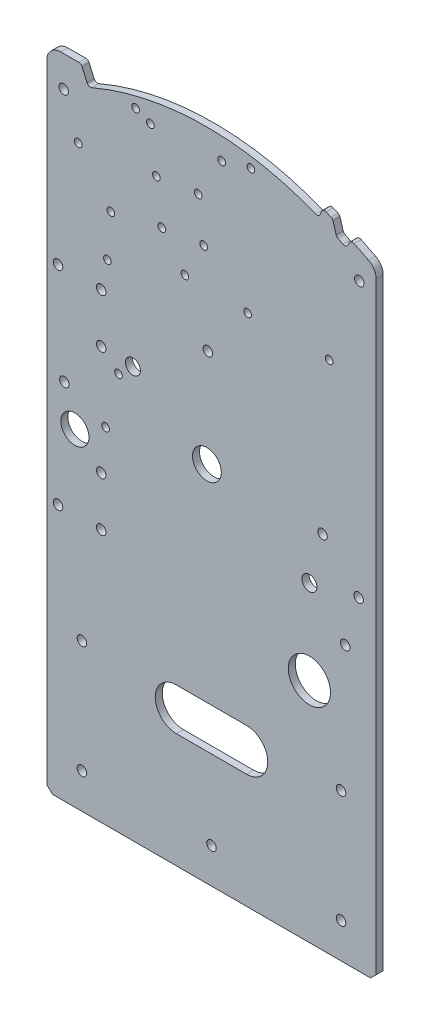
from build123d import *

# Parameters (mm, degrees)
BOSS_EXTRUDE1_DEPTH             = 3.175
SKETCH2_R                       = 6.50875
CUT_EXTRUDE1_DEPTH              = 268.458155353
F_4_CLEARANCE_HOLE1_D           = 3.4544
F_6_CLEARANCE_HOLE2_D           = 4.3053
F_4_CLEARANCE_HOLE2_D           = 3.4544
F_1_4_CLEARANCE_HOLE2_D         = 6.7564
SKETCH15_W                      = 148.719955274
SKETCH15_H                      = 114.3
BOSS_EXTRUDE2_DEPTH             = 3.175
F_6_CLEARANCE_HOLE3_D           = 4.3053
CHAMFER1_SIZE                   = 2.54
F_6_CLEARANCE_HOLE4_D           = 4.3053
F_4_CLEARANCE_HOLE3_D           = 3.4544
F_6_CLEARANCE_HOLE1_D           = 4.3053
DELETEFACE1_START               = -3.175
DELETEFACE1_OUTLINE_R           = 2.15265
DELETEFACE1_DEPTH               = 3.175
F_1_2_0_5_DIAMETER_HOLE1_D      = 12.7
F_1_4_CLEARANCE_HOLE1_D         = 6.7564
F_3_4_0_75_DIAMETER_HOLE1_D     = 19.05
F_3_4_START                     = -3.175
F_3_4_0_75_DIAMETER_SLOT1_DEPTH = 3.175
FILLET1_R                       = 1.5875
FILLET2_R                       = 6.35


# Read off the part's stored shape, not the designer's step: DeleteFace1, 3/4 (0.75) Diameter Slot1
with BuildPart() as part:
    # Sketch1 → Boss-Extrude1 (new body)
    with BuildSketch(Plane.XY):
        with BuildLine():
            Line((-37.014245685, -65.193042462), (-37.014245685, -242.993042462))
            Line((-37.014245685, -242.993042462), (111.705709589, -242.993042462))
            Line((111.705709589, -242.993042462), (111.705709589, -78.837199032))
            Line((111.705709589, -78.837199032), (100.315919098, -73.219132409))
            Line((100.315919098, -73.219132409), (98.04889923, -77.407452736))
            ThreePointArc((98.04889923, -77.407452736), (95.944511883, -76.292837527), (93.820355363, -75.216374688))
            Line((93.820355363, -75.216374688), (91.991959695, -69.073183497))
            Line((91.991959695, -69.073183497), (87.625459733, -67.171845985))
            Line((87.625459733, -67.171845985), (85.800454124, -71.570795948))
            ThreePointArc((85.800454124, -71.570795948), (33.712742218, -61.505341345), (-18.130011823, -72.76464689))
            Line((-18.130011823, -72.76464689), (-20.055584156, -68.408779876))
            Line((-20.055584156, -68.408779876), (-21.49685031, -65.148469374))
            Line((-21.49685031, -65.148469374), (-28.430836618, -65.168386968))
            Line((-28.430836618, -65.168386968), (-37.014245685, -65.193042462))
        make_face()
    extrude(amount=-BOSS_EXTRUDE1_DEPTH)

    # Sketch2 → Cut-Extrude1 (cut, through all)
    with BuildSketch(Plane.XY):
        with Locations((35.268404938, -193.371995598)):
            Circle(SKETCH2_R)
    extrude(amount=-CUT_EXTRUDE1_DEPTH, mode=Mode.SUBTRACT)

    # #4 Clearance Hole1 (through all)
    with Locations(Plane.XY):
        with Locations((41.939844363, -71.488811907), (9.789450293, -73.011273216), (90.488583573, -124.967078721), (53.658735514, -125.072870965), (25.338848707, -124.341705755), (-9.634401538, -135.888162669), (55.145248163, -67.700310852), (3.101953943, -70.270684884)):
            Hole(F_4_CLEARANCE_HOLE1_D / 2)

    # #6 Clearance Hole2 (through all)
    with Locations(Plane.XY):
        with Locations((-29.394245685, -79.071995598), (104.085709589, -87.326995598), (35.695953558, -148.921995598), (26.485754315, -79.071995598)):
            Hole(F_6_CLEARANCE_HOLE2_D / 2)

    # #4 Clearance Hole2 (through all)
    with Locations(Plane.XY):
        with Locations((-8.073739309, -116.319383279), (-22.812224861, -96.782058908), (-10.478566815, -201.738004366), (-4.603970045, -177.980497914)):
            Hole(F_4_CLEARANCE_HOLE2_D / 2)

    # 1/4 Clearance Hole2 (through all)
    with Locations(Plane.XY):
        with Locations((81.551198953, -216.670082089)):
            Hole(F_1_4_CLEARANCE_HOLE2_D / 2)

    # Sketch15 → Boss-Extrude2 (add, through all)
    with BuildSketch(Plane.XY):
        with Locations((37.345731952, -300.143042462)):
            Rectangle(SKETCH15_W, SKETCH15_H)
    extrude(amount=-BOSS_EXTRUDE2_DEPTH)

    # #6 Clearance Hole3 (through all)
    with Locations(Plane.XY):
        with Locations((-29.076745685, -193.371995598), (103.768209589, -211.243042462), (87.470455138, -194.579117263), (97.722907594, -232.841790729)):
            Hole(F_6_CLEARANCE_HOLE3_D / 2)

    # Chamfer1
    chamfer1_edges = [part.edges().sort_by_distance(p)[0] for p in [
        (-37.014245685, -357.293042462, -1.5875),
        (111.705709589, -357.293042462, -1.5875),
    ]]
    chamfer(chamfer1_edges, length=CHAMFER1_SIZE)

    # #6 Clearance Hole4 (through all)
    with Locations(Plane.XY):
        with Locations((95.830709589, -341.418042462), (37.345731952, -341.418042462), (-21.139245685, -341.418042462), (95.830709589, -290.618042462), (-21.139245685, -290.618042462)):
            Hole(F_6_CLEARANCE_HOLE4_D / 2)

    # #4 Clearance Hole3 (through all)
    with Locations(Plane.XY):
        with Locations((31.354393952, -89.701374676), (12.464345577, -92.164821934), (14.927792835, -111.054870309), (33.81784121, -108.591423051)):
            Hole(F_4_CLEARANCE_HOLE3_D / 2)

    # #6 Clearance Hole1 (through all)
    with Locations(Plane.XY):
        with Locations((-12.436474575, -171.172679278), (-12.436474575, -148.947679278), (-31.934245685, -148.947679278), (-31.934245685, -242.800679278), (-12.436474575, -242.800679278), (-12.436474575, -220.575679278)):
            Hole(F_6_CLEARANCE_HOLE1_D / 2)

    # DeleteFace1 outline → DeleteFace1 (add)
    with BuildSketch(Plane.XY.offset(DELETEFACE1_START)):
        with Locations((26.485754315, -79.071995598)):
            Circle(DELETEFACE1_OUTLINE_R)
    extrude(amount=DELETEFACE1_DEPTH)

    # 1/2 (0.5) Diameter Hole1 (through all)
    with Locations(Plane.XY):
        with Locations((-24.314245685, -209.463179278)):
            Hole(F_1_2_0_5_DIAMETER_HOLE1_D / 2)

    # 1/4 Clearance Hole1 (through all)
    with Locations(Plane.XY):
        with Locations((1.896126146, -171.892035997)):
            Hole(F_1_4_CLEARANCE_HOLE1_D / 2)

    # 3/4 (0.75) Diameter Hole1 (through all)
    with Locations(Plane.XY):
        with Locations((81.551198953, -254.770082089)):
            Hole(F_3_4_0_75_DIAMETER_HOLE1_D / 2)

    # 3/4 (0.75) Diameter Slot1 outline → 3/4 (0.75) Diameter Slot1 (cut)
    with BuildSketch(Plane.XY.offset(F_3_4_START)):
        with BuildLine():
            Line((21.470731952, -305.605683453), (53.220731952, -305.605683453))
            ThreePointArc((53.220731952, -305.605683453), (62.745731952, -296.080683453), (53.220731952, -286.555683453))
            Line((53.220731952, -286.555683453), (21.470731952, -286.555683453))
            ThreePointArc((21.470731952, -286.555683453), (11.945731952, -296.080683453), (21.470731952, -305.605683453))
        make_face()
    extrude(amount=F_3_4_0_75_DIAMETER_SLOT1_DEPTH, mode=Mode.SUBTRACT)

    # Fillet1
    fillet1_edges = [part.edges().sort_by_distance(p)[0] for p in [
        (-21.49685031, -65.148469374, -1.5875),
        (-18.130011823, -72.76464689, -1.5875),
        (85.800454124, -71.570795948, -1.5875),
        (87.625459733, -67.171845985, -1.5875),
        (91.991959695, -69.073183497, -1.5875),
        (93.820355363, -75.216374688, -1.5875),
        (98.04889923, -77.407452736, -1.5875),
        (100.315919098, -73.219132409, -1.5875),
    ]]
    fillet(fillet1_edges, radius=FILLET1_R)

    # Fillet2
    fillet2_edges = [part.edges().sort_by_distance(p)[0] for p in [
        (111.705709589, -78.837199032, -1.5875),
        (-37.014245685, -65.193042462, -1.5875),
    ]]
    fillet(fillet2_edges, radius=FILLET2_R)


solid = part.part
